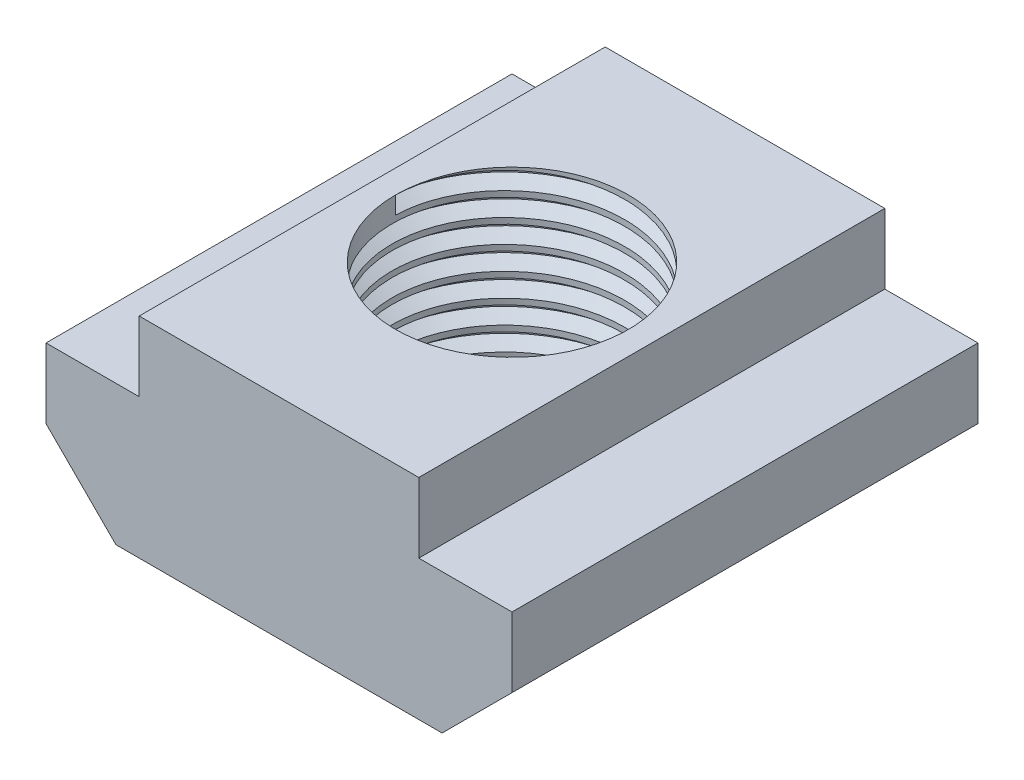
from build123d import *

# Parameters (mm, degrees)
BOSS_EXTRUDE1_DEPTH = 10
SKETCH2_R           = 2.5
CUT_EXTRUDE1_DEPTH  = 14.874436926
THREAD1_PITCH       = 0.5


with BuildPart() as part:
    # Sketch1 → Boss-Extrude1 (new body)
    with BuildSketch(Plane.XY):
        Polygon((0, 0), (7, 0), (8.5, 1.5), (8.5, 3), (6.5, 3), (6.5, 4.5), (0.5, 4.5), (0.5, 3), (-1.5, 3), (-1.5, 1.5), align=None)
    extrude(amount=BOSS_EXTRUDE1_DEPTH)

    # Sketch2 → Cut-Extrude1 (cut, through all)
    with BuildSketch(Plane(origin=(0, 4.5, 0), x_dir=(1, 0, 0), z_dir=(0, 1, 0))):
        with Locations(Location((3.5, -5, 0), (0, 0, 270))):
            Circle(SKETCH2_R)
    extrude(amount=-CUT_EXTRUDE1_DEPTH, mode=Mode.SUBTRACT)

    # Thread1: the profile of Thread Profile2 profile screwed along a right-hand helix of 9 turns, 6 arcs to a turn; built about Z, then put on its axis
    thread1_z = Axis((0, 0, 0), (0, 0, 1))
    thread1_corners = [(2.4997, 0, -0.000173205), (2.770632937, 0, 0.156249999), (2.770632937, 0, 0.218749999), (2.4997, 0, 0.375173204)]
    with BuildLine(mode=Mode.PRIVATE) as thread1_profile:
        Line(thread1_corners[0], thread1_corners[1])
        Line(thread1_corners[1], thread1_corners[2])
        Line(thread1_corners[2], thread1_corners[3])
        Line(thread1_corners[3], thread1_corners[0])
    thread1_cap = Face(thread1_profile.wire())
    thread1_turn_angles = [0, 30, 60, 90, 120, 150, 180, 210, 240, 270, 300, 330, 360]
    thread1_turn_weights = [1, 0.8660254037844387, 1, 0.8660254037844387, 1, 0.8660254037844387, 1, 0.8660254037844387, 1, 0.8660254037844387, 1, 0.8660254037844387, 1]
    thread1_turn_rails = [Edge.make_bspline([Vector(p[0], p[1], 0).rotate(thread1_z, thread1_turn_angles[k]) / thread1_turn_weights[k] + Vector(0, 0, p[2] + THREAD1_PITCH * thread1_turn_angles[k] / 360) for k in range(13)], [0, 0, 0, 1, 1, 2, 2, 3, 3, 4, 4, 5, 5, 6, 6, 6], 2, thread1_turn_weights) for p in thread1_corners]
    thread1_turn_sides = [Face.make_surface_from_curves(thread1_turn_rails[p[0]], thread1_turn_rails[p[1]]) for p in [(0, 1), (1, 2), (2, 3), (3, 0)]]
    thread1 = Plane(origin=(3.5, 4.5, 5), x_dir=(-1, 0, 0), z_dir=(0, -1, 0)) * Solid(Shell([*[p.moved(Location((0, 0, THREAD1_PITCH * i))) for i in range(9) for p in thread1_turn_sides], thread1_cap, thread1_cap.rotate(thread1_z, 3240).moved(Location((0, 0, THREAD1_PITCH * 3240 / 360)))]))
    add(thread1, mode=Mode.SUBTRACT)


solid = part.part
